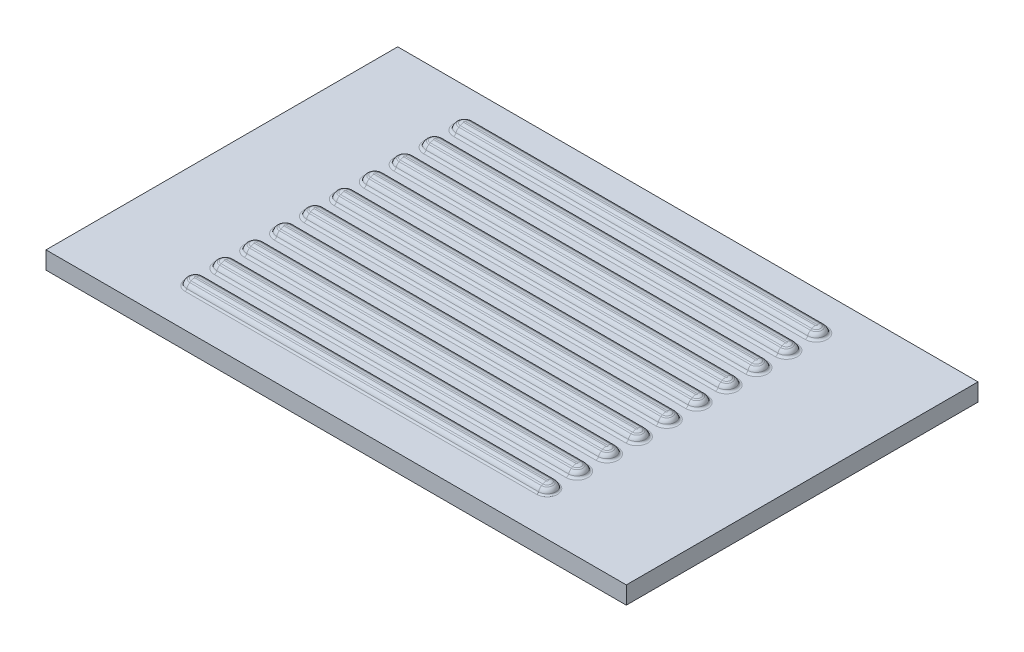
from build123d import *
from OCP.BRepFilletAPI import BRepFilletAPI_MakeChamfer

# Parameters (mm, degrees)
SKETCH1_W                   = 30000
SKETCH1_H                   = 20000
BOSS_EXTRUDE1_DEPTH         = 1000
SKETCH4_W                   = 3000
SKETCH4_H                   = 20000
BOSS_EXTRUDE3_DEPTH         = 1000
BOSS_EXTRUDE2_DEPTH         = 400
CHAMFER1_SIZE               = 200
CHAMFER1_SIZE2              = 346.410161514
FILLET3_R                   = 400
FILLET4_R                   = 350
FILLET2_R                   = 100
LPATTERN3_COUNT             = 10
LPATTERN3_PITCH             = 1700
CHAMFER1_OF_LPATTERN3_SIZE  = 200
CHAMFER1_OF_LPATTERN3_SIZE2 = 346.410161514
FILLET3_OF_LPATTERN3_R      = 400
FILLET4_OF_LPATTERN3_R      = 350
FILLET5_R                   = 150
FILLET6_R                   = 150
FILLET7_R                   = 150
FILLET8_R                   = 150
FILLET9_R                   = 150
FILLET10_R                  = 150
FILLET11_R                  = 150
FILLET12_R                  = 150
FILLET13_R                  = 150


with BuildPart() as part:
    # Sketch1 → Boss-Extrude1 (new body)
    with BuildSketch(Plane(origin=(0, 0, 0), x_dir=(1, 0, 0), z_dir=(0, 1, 0))):
        Rectangle(SKETCH1_W, SKETCH1_H)
    extrude(amount=-BOSS_EXTRUDE1_DEPTH)

    # Sketch4 → Boss-Extrude3 (add)
    with BuildSketch(Plane(origin=(0, 0, 0), x_dir=(1, 0, 0), z_dir=(0, 1, 0))):
        with Locations((-16500, 0)):
            Rectangle(SKETCH4_W, SKETCH4_H)
    extrude(amount=-BOSS_EXTRUDE3_DEPTH)

    # Sketch3 → Boss-Extrude2 (add)
    with BuildSketch(Plane(origin=(0, 0, 0), x_dir=(1, 0, 0), z_dir=(0, 1, 0))):
        with BuildLine():
            Line((-12000, -7000), (8000, -7000))
            ThreePointArc((8000, -7000), (8500, -7500), (8000, -8000))
            Line((8000, -8000), (-12000, -8000))
            ThreePointArc((-12000, -8000), (-12500, -7500), (-12000, -7000))
        make_face()
    boss_extrude2 = extrude(amount=BOSS_EXTRUDE2_DEPTH)

    # Chamfer1: one chamfer whose edges measure the first distance from different faces: ONE call of the kernel's chamfer builder (chamfer() names one face for all edges)
    chamfer1_edges_1 = [part.edges().sort_by_distance(p)[0] for p in [
        (-12500, 400, 7500),
    ]]
    chamfer1_side_1 = [part.faces().sort_by_distance(p)[0] for p in [
        (-12500, 200, 7500),
    ]]
    chamfer1_edges_2 = [part.edges().sort_by_distance(p)[0] for p in [
        (-2000, 400, 8000),
    ]]
    chamfer1_side_2 = [part.faces().sort_by_distance(p)[0] for p in [
        (-2000, 200, 8000),
    ]]
    chamfer1_edges_3 = [part.edges().sort_by_distance(p)[0] for p in [
        (8500, 400, 7500),
    ]]
    chamfer1_side_3 = [part.faces().sort_by_distance(p)[0] for p in [
        (8500, 200, 7500),
    ]]
    chamfer1_edges_4 = [part.edges().sort_by_distance(p)[0] for p in [
        (-2000, 400, 7000),
    ]]
    chamfer1_side_4 = [part.faces().sort_by_distance(p)[0] for p in [
        (-2000, 200, 7000),
    ]]
    chamfer1 = BRepFilletAPI_MakeChamfer(part.part.solid().wrapped)
    for e in chamfer1_edges_1:
        chamfer1.Add(CHAMFER1_SIZE, CHAMFER1_SIZE2, e.wrapped, chamfer1_side_1[0].wrapped)  # the first distance lies on this face
    for e in chamfer1_edges_2:
        chamfer1.Add(CHAMFER1_SIZE, CHAMFER1_SIZE2, e.wrapped, chamfer1_side_2[0].wrapped)  # the first distance lies on this face
    for e in chamfer1_edges_3:
        chamfer1.Add(CHAMFER1_SIZE, CHAMFER1_SIZE2, e.wrapped, chamfer1_side_3[0].wrapped)  # the first distance lies on this face
    for e in chamfer1_edges_4:
        chamfer1.Add(CHAMFER1_SIZE, CHAMFER1_SIZE2, e.wrapped, chamfer1_side_4[0].wrapped)  # the first distance lies on this face
    add(Compound.cast(chamfer1.Shape()), mode=Mode.REPLACE)

    # Fillet3
    fillet3_edges = [part.edges().sort_by_distance(p)[0] for p in [
        (-12153.589838486, 400, 7500),
        (-2000, 400, 7653.589838486),
        (8153.589838486, 400, 7500),
        (-2000, 400, 7346.410161514),
    ]]
    fillet(fillet3_edges, radius=FILLET3_R)

    # Fillet4
    # the kernel refuses this fillet: 350 mm, written as the material it takes off along each edge
    with BuildSketch(Plane(origin=(-12000, 200, 7500), x_dir=(0, 0, 1), z_dir=(1, 0, 0))) as fillet4_piece_1:
        with BuildLine():
            CenterArc((150.006157763, 202.076149403), FILLET4_R, 300, 59.660127726)
            Line((500, 200), (506.999876845, 199.958477012))
            ThreePointArc((506.999876845, 199.958477012), (507, 100), (507, 0))
            Line((507, 0), (503.5, -6.062177826))
            Line((503.5, -6.062177826), (328.506157763, -107.094919748))
            Line((328.506157763, -107.094919748), (325.006157763, -101.032741922))
        make_face()
    revolve(axis=Axis((-12000, 200, 7500), (0, -1, 0)), revolution_arc=180, mode=Mode.SUBTRACT)
    with BuildSketch(Plane(origin=(8000, 200, 8000), x_dir=(0, 0.49999999999999817, -0.8660254037844398), z_dir=(-1, 0, 0)), Plane(origin=(-12000, 200, 7000), x_dir=(0, 0.4999999999999985, 0.8660254037844395), z_dir=(1, 0, 0))) as fillet4_piece_2:
        with BuildLine():
            CenterArc((202.065483844, 350), FILLET4_R, 210.339872274, 59.660127726)
            Line((-100, 173.205080757), (-106.041309677, 169.669182372))
            ThreePointArc((-106.041309677, 169.669182372), (-56.062177826, 83.102540378), (-6.062177826, -3.5))
            Line((-6.062177826, -3.5), (0, -7))
            Line((0, -7), (202.065483844, -7))
            Line((202.065483844, -7), (202.065483844, 0))
        make_face()
    extrude(amount=20000, mode=Mode.SUBTRACT)
    with BuildSketch(Plane(origin=(8000, 200, 7500), x_dir=(0, 0, -1), z_dir=(-1, 0, 0))) as fillet4_piece_3:
        with BuildLine():
            CenterArc((150.006157763, 202.076149403), FILLET4_R, 300, 59.660127726)
            Line((500, 200), (506.999876845, 199.958477012))
            ThreePointArc((506.999876845, 199.958477012), (507, 100), (507, 0))
            Line((507, 0), (503.5, -6.062177826))
            Line((503.5, -6.062177826), (328.506157763, -107.094919748))
            Line((328.506157763, -107.094919748), (325.006157763, -101.032741922))
        make_face()
    revolve(axis=Axis((8000, 200, 7500), (0, -1, 0)), revolution_arc=180, mode=Mode.SUBTRACT)

    # Fillet2
    fillet2_edges = [part.edges().sort_by_distance(p)[0] for p in [
        (-12500, 0, 7500),
        (-2000, 0, 8000),
        (8500, 0, 7500),
        (-2000, 0, 7000),
    ]]
    fillet(fillet2_edges, radius=FILLET2_R)

    # LPattern3: Boss-Extrude2 ×10
    with Locations(*[(0, 0, -i * LPATTERN3_PITCH) for i in range(1, LPATTERN3_COUNT)]):
        add(boss_extrude2)

    # Chamfer1 of LPattern3: one chamfer whose edges measure the first distance from different faces: ONE call of the kernel's chamfer builder (chamfer() names one face for all edges)
    chamfer1_of_lpattern3_edges_1 = [part.edges().sort_by_distance(p)[0] for p in [
        (-12500, 400, 5800),
    ]]
    chamfer1_of_lpattern3_side_1 = [part.faces().sort_by_distance(p)[0] for p in [
        (-12500, 200, 5800),
    ]]
    chamfer1_of_lpattern3_edges_2 = [part.edges().sort_by_distance(p)[0] for p in [
        (-2000, 400, 6300),
    ]]
    chamfer1_of_lpattern3_side_2 = [part.faces().sort_by_distance(p)[0] for p in [
        (-2000, 200, 6300),
    ]]
    chamfer1_of_lpattern3_edges_3 = [part.edges().sort_by_distance(p)[0] for p in [
        (8500, 400, 5800),
    ]]
    chamfer1_of_lpattern3_side_3 = [part.faces().sort_by_distance(p)[0] for p in [
        (8500, 200, 5800),
    ]]
    chamfer1_of_lpattern3_edges_4 = [part.edges().sort_by_distance(p)[0] for p in [
        (-2000, 400, 5300),
    ]]
    chamfer1_of_lpattern3_side_4 = [part.faces().sort_by_distance(p)[0] for p in [
        (-2000, 200, 5300),
    ]]
    chamfer1_of_lpattern3_edges_5 = [part.edges().sort_by_distance(p)[0] for p in [
        (-12500, 400, 4100),
    ]]
    chamfer1_of_lpattern3_side_5 = [part.faces().sort_by_distance(p)[0] for p in [
        (-12500, 200, 4100),
    ]]
    chamfer1_of_lpattern3_edges_6 = [part.edges().sort_by_distance(p)[0] for p in [
        (-2000, 400, 4600),
    ]]
    chamfer1_of_lpattern3_side_6 = [part.faces().sort_by_distance(p)[0] for p in [
        (-2000, 200, 4600),
    ]]
    chamfer1_of_lpattern3_edges_7 = [part.edges().sort_by_distance(p)[0] for p in [
        (8500, 400, 4100),
    ]]
    chamfer1_of_lpattern3_side_7 = [part.faces().sort_by_distance(p)[0] for p in [
        (8500, 200, 4100),
    ]]
    chamfer1_of_lpattern3_edges_8 = [part.edges().sort_by_distance(p)[0] for p in [
        (-2000, 400, 3600),
    ]]
    chamfer1_of_lpattern3_side_8 = [part.faces().sort_by_distance(p)[0] for p in [
        (-2000, 200, 3600),
    ]]
    chamfer1_of_lpattern3_edges_9 = [part.edges().sort_by_distance(p)[0] for p in [
        (-12500, 400, 2400),
    ]]
    chamfer1_of_lpattern3_side_9 = [part.faces().sort_by_distance(p)[0] for p in [
        (-12500, 200, 2400),
    ]]
    chamfer1_of_lpattern3_edges_10 = [part.edges().sort_by_distance(p)[0] for p in [
        (-2000, 400, 2900),
    ]]
    chamfer1_of_lpattern3_side_10 = [part.faces().sort_by_distance(p)[0] for p in [
        (-2000, 200, 2900),
    ]]
    chamfer1_of_lpattern3_edges_11 = [part.edges().sort_by_distance(p)[0] for p in [
        (8500, 400, 2400),
    ]]
    chamfer1_of_lpattern3_side_11 = [part.faces().sort_by_distance(p)[0] for p in [
        (8500, 200, 2400),
    ]]
    chamfer1_of_lpattern3_edges_12 = [part.edges().sort_by_distance(p)[0] for p in [
        (-2000, 400, 1900),
    ]]
    chamfer1_of_lpattern3_side_12 = [part.faces().sort_by_distance(p)[0] for p in [
        (-2000, 200, 1900),
    ]]
    chamfer1_of_lpattern3_edges_13 = [part.edges().sort_by_distance(p)[0] for p in [
        (-12500, 400, 700),
    ]]
    chamfer1_of_lpattern3_side_13 = [part.faces().sort_by_distance(p)[0] for p in [
        (-12500, 200, 700),
    ]]
    chamfer1_of_lpattern3_edges_14 = [part.edges().sort_by_distance(p)[0] for p in [
        (-2000, 400, 1200),
    ]]
    chamfer1_of_lpattern3_side_14 = [part.faces().sort_by_distance(p)[0] for p in [
        (-2000, 200, 1200),
    ]]
    chamfer1_of_lpattern3_edges_15 = [part.edges().sort_by_distance(p)[0] for p in [
        (8500, 400, 700),
    ]]
    chamfer1_of_lpattern3_side_15 = [part.faces().sort_by_distance(p)[0] for p in [
        (8500, 200, 700),
    ]]
    chamfer1_of_lpattern3_edges_16 = [part.edges().sort_by_distance(p)[0] for p in [
        (-2000, 400, 200),
    ]]
    chamfer1_of_lpattern3_side_16 = [part.faces().sort_by_distance(p)[0] for p in [
        (-2000, 200, 200),
    ]]
    chamfer1_of_lpattern3_edges_17 = [part.edges().sort_by_distance(p)[0] for p in [
        (-12500, 400, -1000),
    ]]
    chamfer1_of_lpattern3_side_17 = [part.faces().sort_by_distance(p)[0] for p in [
        (-12500, 200, -1000),
    ]]
    chamfer1_of_lpattern3_edges_18 = [part.edges().sort_by_distance(p)[0] for p in [
        (-2000, 400, -500),
    ]]
    chamfer1_of_lpattern3_side_18 = [part.faces().sort_by_distance(p)[0] for p in [
        (-2000, 200, -500),
    ]]
    chamfer1_of_lpattern3_edges_19 = [part.edges().sort_by_distance(p)[0] for p in [
        (8500, 400, -1000),
    ]]
    chamfer1_of_lpattern3_side_19 = [part.faces().sort_by_distance(p)[0] for p in [
        (8500, 200, -1000),
    ]]
    chamfer1_of_lpattern3_edges_20 = [part.edges().sort_by_distance(p)[0] for p in [
        (-2000, 400, -1500),
    ]]
    chamfer1_of_lpattern3_side_20 = [part.faces().sort_by_distance(p)[0] for p in [
        (-2000, 200, -1500),
    ]]
    chamfer1_of_lpattern3_edges_21 = [part.edges().sort_by_distance(p)[0] for p in [
        (-12500, 400, -2700),
    ]]
    chamfer1_of_lpattern3_side_21 = [part.faces().sort_by_distance(p)[0] for p in [
        (-12500, 200, -2700),
    ]]
    chamfer1_of_lpattern3_edges_22 = [part.edges().sort_by_distance(p)[0] for p in [
        (-2000, 400, -2200),
    ]]
    chamfer1_of_lpattern3_side_22 = [part.faces().sort_by_distance(p)[0] for p in [
        (-2000, 200, -2200),
    ]]
    chamfer1_of_lpattern3_edges_23 = [part.edges().sort_by_distance(p)[0] for p in [
        (8500, 400, -2700),
    ]]
    chamfer1_of_lpattern3_side_23 = [part.faces().sort_by_distance(p)[0] for p in [
        (8500, 200, -2700),
    ]]
    chamfer1_of_lpattern3_edges_24 = [part.edges().sort_by_distance(p)[0] for p in [
        (-2000, 400, -3200),
    ]]
    chamfer1_of_lpattern3_side_24 = [part.faces().sort_by_distance(p)[0] for p in [
        (-2000, 200, -3200),
    ]]
    chamfer1_of_lpattern3_edges_25 = [part.edges().sort_by_distance(p)[0] for p in [
        (-12500, 400, -4400),
    ]]
    chamfer1_of_lpattern3_side_25 = [part.faces().sort_by_distance(p)[0] for p in [
        (-12500, 200, -4400),
    ]]
    chamfer1_of_lpattern3_edges_26 = [part.edges().sort_by_distance(p)[0] for p in [
        (-2000, 400, -3900),
    ]]
    chamfer1_of_lpattern3_side_26 = [part.faces().sort_by_distance(p)[0] for p in [
        (-2000, 200, -3900),
    ]]
    chamfer1_of_lpattern3_edges_27 = [part.edges().sort_by_distance(p)[0] for p in [
        (8500, 400, -4400),
    ]]
    chamfer1_of_lpattern3_side_27 = [part.faces().sort_by_distance(p)[0] for p in [
        (8500, 200, -4400),
    ]]
    chamfer1_of_lpattern3_edges_28 = [part.edges().sort_by_distance(p)[0] for p in [
        (-2000, 400, -4900),
    ]]
    chamfer1_of_lpattern3_side_28 = [part.faces().sort_by_distance(p)[0] for p in [
        (-2000, 200, -4900),
    ]]
    chamfer1_of_lpattern3_edges_29 = [part.edges().sort_by_distance(p)[0] for p in [
        (-12500, 400, -6100),
    ]]
    chamfer1_of_lpattern3_side_29 = [part.faces().sort_by_distance(p)[0] for p in [
        (-12500, 200, -6100),
    ]]
    chamfer1_of_lpattern3_edges_30 = [part.edges().sort_by_distance(p)[0] for p in [
        (-2000, 400, -5600),
    ]]
    chamfer1_of_lpattern3_side_30 = [part.faces().sort_by_distance(p)[0] for p in [
        (-2000, 200, -5600),
    ]]
    chamfer1_of_lpattern3_edges_31 = [part.edges().sort_by_distance(p)[0] for p in [
        (8500, 400, -6100),
    ]]
    chamfer1_of_lpattern3_side_31 = [part.faces().sort_by_distance(p)[0] for p in [
        (8500, 200, -6100),
    ]]
    chamfer1_of_lpattern3_edges_32 = [part.edges().sort_by_distance(p)[0] for p in [
        (-2000, 400, -6600),
    ]]
    chamfer1_of_lpattern3_side_32 = [part.faces().sort_by_distance(p)[0] for p in [
        (-2000, 200, -6600),
    ]]
    chamfer1_of_lpattern3_edges_33 = [part.edges().sort_by_distance(p)[0] for p in [
        (-12500, 400, -7800),
    ]]
    chamfer1_of_lpattern3_side_33 = [part.faces().sort_by_distance(p)[0] for p in [
        (-12500, 200, -7800),
    ]]
    chamfer1_of_lpattern3_edges_34 = [part.edges().sort_by_distance(p)[0] for p in [
        (-2000, 400, -7300),
    ]]
    chamfer1_of_lpattern3_side_34 = [part.faces().sort_by_distance(p)[0] for p in [
        (-2000, 200, -7300),
    ]]
    chamfer1_of_lpattern3_edges_35 = [part.edges().sort_by_distance(p)[0] for p in [
        (8500, 400, -7800),
    ]]
    chamfer1_of_lpattern3_side_35 = [part.faces().sort_by_distance(p)[0] for p in [
        (8500, 200, -7800),
    ]]
    chamfer1_of_lpattern3_edges_36 = [part.edges().sort_by_distance(p)[0] for p in [
        (-2000, 400, -8300),
    ]]
    chamfer1_of_lpattern3_side_36 = [part.faces().sort_by_distance(p)[0] for p in [
        (-2000, 200, -8300),
    ]]
    chamfer1_of_lpattern3 = BRepFilletAPI_MakeChamfer(part.part.solid().wrapped)
    for e in chamfer1_of_lpattern3_edges_1:
        chamfer1_of_lpattern3.Add(CHAMFER1_OF_LPATTERN3_SIZE, CHAMFER1_OF_LPATTERN3_SIZE2, e.wrapped, chamfer1_of_lpattern3_side_1[0].wrapped)  # the first distance lies on this face
    for e in chamfer1_of_lpattern3_edges_2:
        chamfer1_of_lpattern3.Add(CHAMFER1_OF_LPATTERN3_SIZE, CHAMFER1_OF_LPATTERN3_SIZE2, e.wrapped, chamfer1_of_lpattern3_side_2[0].wrapped)  # the first distance lies on this face
    for e in chamfer1_of_lpattern3_edges_3:
        chamfer1_of_lpattern3.Add(CHAMFER1_OF_LPATTERN3_SIZE, CHAMFER1_OF_LPATTERN3_SIZE2, e.wrapped, chamfer1_of_lpattern3_side_3[0].wrapped)  # the first distance lies on this face
    for e in chamfer1_of_lpattern3_edges_4:
        chamfer1_of_lpattern3.Add(CHAMFER1_OF_LPATTERN3_SIZE, CHAMFER1_OF_LPATTERN3_SIZE2, e.wrapped, chamfer1_of_lpattern3_side_4[0].wrapped)  # the first distance lies on this face
    for e in chamfer1_of_lpattern3_edges_5:
        chamfer1_of_lpattern3.Add(CHAMFER1_OF_LPATTERN3_SIZE, CHAMFER1_OF_LPATTERN3_SIZE2, e.wrapped, chamfer1_of_lpattern3_side_5[0].wrapped)  # the first distance lies on this face
    for e in chamfer1_of_lpattern3_edges_6:
        chamfer1_of_lpattern3.Add(CHAMFER1_OF_LPATTERN3_SIZE, CHAMFER1_OF_LPATTERN3_SIZE2, e.wrapped, chamfer1_of_lpattern3_side_6[0].wrapped)  # the first distance lies on this face
    for e in chamfer1_of_lpattern3_edges_7:
        chamfer1_of_lpattern3.Add(CHAMFER1_OF_LPATTERN3_SIZE, CHAMFER1_OF_LPATTERN3_SIZE2, e.wrapped, chamfer1_of_lpattern3_side_7[0].wrapped)  # the first distance lies on this face
    for e in chamfer1_of_lpattern3_edges_8:
        chamfer1_of_lpattern3.Add(CHAMFER1_OF_LPATTERN3_SIZE, CHAMFER1_OF_LPATTERN3_SIZE2, e.wrapped, chamfer1_of_lpattern3_side_8[0].wrapped)  # the first distance lies on this face
    for e in chamfer1_of_lpattern3_edges_9:
        chamfer1_of_lpattern3.Add(CHAMFER1_OF_LPATTERN3_SIZE, CHAMFER1_OF_LPATTERN3_SIZE2, e.wrapped, chamfer1_of_lpattern3_side_9[0].wrapped)  # the first distance lies on this face
    for e in chamfer1_of_lpattern3_edges_10:
        chamfer1_of_lpattern3.Add(CHAMFER1_OF_LPATTERN3_SIZE, CHAMFER1_OF_LPATTERN3_SIZE2, e.wrapped, chamfer1_of_lpattern3_side_10[0].wrapped)  # the first distance lies on this face
    for e in chamfer1_of_lpattern3_edges_11:
        chamfer1_of_lpattern3.Add(CHAMFER1_OF_LPATTERN3_SIZE, CHAMFER1_OF_LPATTERN3_SIZE2, e.wrapped, chamfer1_of_lpattern3_side_11[0].wrapped)  # the first distance lies on this face
    for e in chamfer1_of_lpattern3_edges_12:
        chamfer1_of_lpattern3.Add(CHAMFER1_OF_LPATTERN3_SIZE, CHAMFER1_OF_LPATTERN3_SIZE2, e.wrapped, chamfer1_of_lpattern3_side_12[0].wrapped)  # the first distance lies on this face
    for e in chamfer1_of_lpattern3_edges_13:
        chamfer1_of_lpattern3.Add(CHAMFER1_OF_LPATTERN3_SIZE, CHAMFER1_OF_LPATTERN3_SIZE2, e.wrapped, chamfer1_of_lpattern3_side_13[0].wrapped)  # the first distance lies on this face
    for e in chamfer1_of_lpattern3_edges_14:
        chamfer1_of_lpattern3.Add(CHAMFER1_OF_LPATTERN3_SIZE, CHAMFER1_OF_LPATTERN3_SIZE2, e.wrapped, chamfer1_of_lpattern3_side_14[0].wrapped)  # the first distance lies on this face
    for e in chamfer1_of_lpattern3_edges_15:
        chamfer1_of_lpattern3.Add(CHAMFER1_OF_LPATTERN3_SIZE, CHAMFER1_OF_LPATTERN3_SIZE2, e.wrapped, chamfer1_of_lpattern3_side_15[0].wrapped)  # the first distance lies on this face
    for e in chamfer1_of_lpattern3_edges_16:
        chamfer1_of_lpattern3.Add(CHAMFER1_OF_LPATTERN3_SIZE, CHAMFER1_OF_LPATTERN3_SIZE2, e.wrapped, chamfer1_of_lpattern3_side_16[0].wrapped)  # the first distance lies on this face
    for e in chamfer1_of_lpattern3_edges_17:
        chamfer1_of_lpattern3.Add(CHAMFER1_OF_LPATTERN3_SIZE, CHAMFER1_OF_LPATTERN3_SIZE2, e.wrapped, chamfer1_of_lpattern3_side_17[0].wrapped)  # the first distance lies on this face
    for e in chamfer1_of_lpattern3_edges_18:
        chamfer1_of_lpattern3.Add(CHAMFER1_OF_LPATTERN3_SIZE, CHAMFER1_OF_LPATTERN3_SIZE2, e.wrapped, chamfer1_of_lpattern3_side_18[0].wrapped)  # the first distance lies on this face
    for e in chamfer1_of_lpattern3_edges_19:
        chamfer1_of_lpattern3.Add(CHAMFER1_OF_LPATTERN3_SIZE, CHAMFER1_OF_LPATTERN3_SIZE2, e.wrapped, chamfer1_of_lpattern3_side_19[0].wrapped)  # the first distance lies on this face
    for e in chamfer1_of_lpattern3_edges_20:
        chamfer1_of_lpattern3.Add(CHAMFER1_OF_LPATTERN3_SIZE, CHAMFER1_OF_LPATTERN3_SIZE2, e.wrapped, chamfer1_of_lpattern3_side_20[0].wrapped)  # the first distance lies on this face
    for e in chamfer1_of_lpattern3_edges_21:
        chamfer1_of_lpattern3.Add(CHAMFER1_OF_LPATTERN3_SIZE, CHAMFER1_OF_LPATTERN3_SIZE2, e.wrapped, chamfer1_of_lpattern3_side_21[0].wrapped)  # the first distance lies on this face
    for e in chamfer1_of_lpattern3_edges_22:
        chamfer1_of_lpattern3.Add(CHAMFER1_OF_LPATTERN3_SIZE, CHAMFER1_OF_LPATTERN3_SIZE2, e.wrapped, chamfer1_of_lpattern3_side_22[0].wrapped)  # the first distance lies on this face
    for e in chamfer1_of_lpattern3_edges_23:
        chamfer1_of_lpattern3.Add(CHAMFER1_OF_LPATTERN3_SIZE, CHAMFER1_OF_LPATTERN3_SIZE2, e.wrapped, chamfer1_of_lpattern3_side_23[0].wrapped)  # the first distance lies on this face
    for e in chamfer1_of_lpattern3_edges_24:
        chamfer1_of_lpattern3.Add(CHAMFER1_OF_LPATTERN3_SIZE, CHAMFER1_OF_LPATTERN3_SIZE2, e.wrapped, chamfer1_of_lpattern3_side_24[0].wrapped)  # the first distance lies on this face
    for e in chamfer1_of_lpattern3_edges_25:
        chamfer1_of_lpattern3.Add(CHAMFER1_OF_LPATTERN3_SIZE, CHAMFER1_OF_LPATTERN3_SIZE2, e.wrapped, chamfer1_of_lpattern3_side_25[0].wrapped)  # the first distance lies on this face
    for e in chamfer1_of_lpattern3_edges_26:
        chamfer1_of_lpattern3.Add(CHAMFER1_OF_LPATTERN3_SIZE, CHAMFER1_OF_LPATTERN3_SIZE2, e.wrapped, chamfer1_of_lpattern3_side_26[0].wrapped)  # the first distance lies on this face
    for e in chamfer1_of_lpattern3_edges_27:
        chamfer1_of_lpattern3.Add(CHAMFER1_OF_LPATTERN3_SIZE, CHAMFER1_OF_LPATTERN3_SIZE2, e.wrapped, chamfer1_of_lpattern3_side_27[0].wrapped)  # the first distance lies on this face
    for e in chamfer1_of_lpattern3_edges_28:
        chamfer1_of_lpattern3.Add(CHAMFER1_OF_LPATTERN3_SIZE, CHAMFER1_OF_LPATTERN3_SIZE2, e.wrapped, chamfer1_of_lpattern3_side_28[0].wrapped)  # the first distance lies on this face
    for e in chamfer1_of_lpattern3_edges_29:
        chamfer1_of_lpattern3.Add(CHAMFER1_OF_LPATTERN3_SIZE, CHAMFER1_OF_LPATTERN3_SIZE2, e.wrapped, chamfer1_of_lpattern3_side_29[0].wrapped)  # the first distance lies on this face
    for e in chamfer1_of_lpattern3_edges_30:
        chamfer1_of_lpattern3.Add(CHAMFER1_OF_LPATTERN3_SIZE, CHAMFER1_OF_LPATTERN3_SIZE2, e.wrapped, chamfer1_of_lpattern3_side_30[0].wrapped)  # the first distance lies on this face
    for e in chamfer1_of_lpattern3_edges_31:
        chamfer1_of_lpattern3.Add(CHAMFER1_OF_LPATTERN3_SIZE, CHAMFER1_OF_LPATTERN3_SIZE2, e.wrapped, chamfer1_of_lpattern3_side_31[0].wrapped)  # the first distance lies on this face
    for e in chamfer1_of_lpattern3_edges_32:
        chamfer1_of_lpattern3.Add(CHAMFER1_OF_LPATTERN3_SIZE, CHAMFER1_OF_LPATTERN3_SIZE2, e.wrapped, chamfer1_of_lpattern3_side_32[0].wrapped)  # the first distance lies on this face
    for e in chamfer1_of_lpattern3_edges_33:
        chamfer1_of_lpattern3.Add(CHAMFER1_OF_LPATTERN3_SIZE, CHAMFER1_OF_LPATTERN3_SIZE2, e.wrapped, chamfer1_of_lpattern3_side_33[0].wrapped)  # the first distance lies on this face
    for e in chamfer1_of_lpattern3_edges_34:
        chamfer1_of_lpattern3.Add(CHAMFER1_OF_LPATTERN3_SIZE, CHAMFER1_OF_LPATTERN3_SIZE2, e.wrapped, chamfer1_of_lpattern3_side_34[0].wrapped)  # the first distance lies on this face
    for e in chamfer1_of_lpattern3_edges_35:
        chamfer1_of_lpattern3.Add(CHAMFER1_OF_LPATTERN3_SIZE, CHAMFER1_OF_LPATTERN3_SIZE2, e.wrapped, chamfer1_of_lpattern3_side_35[0].wrapped)  # the first distance lies on this face
    for e in chamfer1_of_lpattern3_edges_36:
        chamfer1_of_lpattern3.Add(CHAMFER1_OF_LPATTERN3_SIZE, CHAMFER1_OF_LPATTERN3_SIZE2, e.wrapped, chamfer1_of_lpattern3_side_36[0].wrapped)  # the first distance lies on this face
    add(Compound.cast(chamfer1_of_lpattern3.Shape()), mode=Mode.REPLACE)

    # Fillet3 of LPattern3
    fillet3_of_lpattern3_edges = [part.edges().sort_by_distance(p)[0] for p in [
        (-12153.589838486, 400, 5800),
        (-2000, 400, 5953.589838486),
        (8153.589838486, 400, 5800),
        (-2000, 400, 5646.410161514),
        (-12153.589838486, 400, 4100),
        (-2000, 400, 4253.589838486),
        (8153.589838486, 400, 4100),
        (-2000, 400, 3946.410161514),
        (-12153.589838486, 400, 2400),
        (-2000, 400, 2553.589838486),
        (8153.589838486, 400, 2400),
        (-2000, 400, 2246.410161514),
        (-12153.589838486, 400, 700),
        (-2000, 400, 853.589838486),
        (8153.589838486, 400, 700),
        (-2000, 400, 546.410161514),
        (-12153.589838486, 400, -1000),
        (-2000, 400, -846.410161514),
        (8153.589838486, 400, -1000),
        (-2000, 400, -1153.589838486),
        (-12153.589838486, 400, -2700),
        (-2000, 400, -2546.410161514),
        (8153.589838486, 400, -2700),
        (-2000, 400, -2853.589838486),
        (-12153.589838486, 400, -4400),
        (-2000, 400, -4246.410161514),
        (8153.589838486, 400, -4400),
        (-2000, 400, -4553.589838486),
        (-12153.589838486, 400, -6100),
        (-2000, 400, -5946.410161514),
        (8153.589838486, 400, -6100),
        (-2000, 400, -6253.589838486),
        (-12153.589838486, 400, -7800),
        (-2000, 400, -7646.410161514),
        (8153.589838486, 400, -7800),
        (-2000, 400, -7953.589838486),
    ]]
    fillet(fillet3_of_lpattern3_edges, radius=FILLET3_OF_LPATTERN3_R)

    # Fillet4 of LPattern3
    # the kernel refuses this fillet: 350 mm, written as the material it takes off along each edge
    with BuildSketch(Plane(origin=(-12000, 200, 5800), x_dir=(0, 0, 1), z_dir=(1, 0, 0))) as fillet4_of_lpattern3_piece_1:
        with BuildLine():
            CenterArc((150.006157763, 202.076149403), FILLET4_OF_LPATTERN3_R, 300, 59.660127726)
            Line((500, 200), (506.999876845, 199.958477012))
            ThreePointArc((506.999876845, 199.958477012), (507, 100), (507, 0))
            Line((507, 0), (503.5, -6.062177826))
            Line((503.5, -6.062177826), (328.506157763, -107.094919748))
            Line((328.506157763, -107.094919748), (325.006157763, -101.032741922))
        make_face()
    revolve(axis=Axis((-12000, 200, 5800), (0, -1, 0)), revolution_arc=180, mode=Mode.SUBTRACT)
    with BuildSketch(Plane(origin=(8000, 200, 6300), x_dir=(0, 0.4999999999999985, -0.8660254037844395), z_dir=(-1, 0, 0)), Plane(origin=(-12000, 200, 5300), x_dir=(0, 0.49999999999999817, 0.8660254037844398), z_dir=(1, 0, 0))) as fillet4_of_lpattern3_piece_2:
        with BuildLine():
            CenterArc((202.065483844, 350), FILLET4_OF_LPATTERN3_R, 210.339872274, 59.660127726)
            Line((-100, 173.205080757), (-106.041309677, 169.669182372))
            ThreePointArc((-106.041309677, 169.669182372), (-56.062177826, 83.102540378), (-6.062177826, -3.5))
            Line((-6.062177826, -3.5), (0, -7))
            Line((0, -7), (202.065483844, -7))
            Line((202.065483844, -7), (202.065483844, 0))
        make_face()
    extrude(amount=20000, mode=Mode.SUBTRACT)
    with BuildSketch(Plane(origin=(8000, 200, 5800), x_dir=(0, 0, -1), z_dir=(-1, 0, 0))) as fillet4_of_lpattern3_piece_3:
        with BuildLine():
            CenterArc((150.006157763, 202.076149403), FILLET4_OF_LPATTERN3_R, 300, 59.660127726)
            Line((500, 200), (506.999876845, 199.958477012))
            ThreePointArc((506.999876845, 199.958477012), (507, 100), (507, 0))
            Line((507, 0), (503.5, -6.062177826))
            Line((503.5, -6.062177826), (328.506157763, -107.094919748))
            Line((328.506157763, -107.094919748), (325.006157763, -101.032741922))
        make_face()
    revolve(axis=Axis((8000, 200, 5800), (0, -1, 0)), revolution_arc=180, mode=Mode.SUBTRACT)
    with BuildSketch(Plane(origin=(-12000, 200, 4100), x_dir=(0, 0, 1), z_dir=(1, 0, 0))) as fillet4_of_lpattern3_piece_4:
        with BuildLine():
            CenterArc((150.006157763, 202.076149403), FILLET4_OF_LPATTERN3_R, 300, 59.660127726)
            Line((325.006157763, -101.032741922), (328.506157763, -107.094919748))
            Line((328.506157763, -107.094919748), (503.5, -6.062177826))
            Line((503.5, -6.062177826), (507, 0))
            ThreePointArc((507, 0), (507, 100), (506.999876845, 199.958477012))
            Line((506.999876845, 199.958477012), (500, 200))
        make_face()
    revolve(axis=Axis((-12000, 200, 4100), (0, -1, 0)), revolution_arc=180, mode=Mode.SUBTRACT)
    with BuildSketch(Plane(origin=(8000, 200, 4600), x_dir=(0, -1, 0), z_dir=(-1, 0, 0)), Plane(origin=(-12000, 200, 3600), x_dir=(0, -1, 0), z_dir=(1, 0, 0)), Plane(origin=(8000, 200, 2900), x_dir=(0, -1, 0), z_dir=(-1, 0, 0)), Plane(origin=(-12000, 200, 1900), x_dir=(0, -1, 0), z_dir=(1, 0, 0)), Plane(origin=(8000, 200, 1200), x_dir=(0, -1, 0), z_dir=(-1, 0, 0)), Plane(origin=(-12000, 200, 200), x_dir=(0, -1, 0), z_dir=(1, 0, 0)), Plane(origin=(8000, 200, -500), x_dir=(0, -1, 0), z_dir=(-1, 0, 0)), Plane(origin=(-12000, 200, -1500), x_dir=(0, -1, 0), z_dir=(1, 0, 0)), Plane(origin=(8000, 200, -2200), x_dir=(0, -1, 0), z_dir=(-1, 0, 0)), Plane(origin=(-12000, 200, -3200), x_dir=(0, -1, 0), z_dir=(1, 0, 0)), Plane(origin=(8000, 200, -3900), x_dir=(0, -1, 0), z_dir=(-1, 0, 0)), Plane(origin=(-12000, 200, -4900), x_dir=(0, -1, 0), z_dir=(1, 0, 0)), Plane(origin=(8000, 200, -5600), x_dir=(0, -1, 0), z_dir=(-1, 0, 0)), Plane(origin=(-12000, 200, -6600), x_dir=(0, -1, 0), z_dir=(1, 0, 0)), Plane(origin=(8000, 200, -7300), x_dir=(0, -1, 0), z_dir=(-1, 0, 0)), Plane(origin=(-12000, 200, -8300), x_dir=(0, -1, 0), z_dir=(1, 0, 0))) as fillet4_of_lpattern3_piece_5:
        with BuildLine():
            CenterArc((202.076149403, -349.993842237), FILLET4_OF_LPATTERN3_R, 90.339872274, 59.660127726)
            Line((-101.032741922, -174.993842237), (-107.094919748, -171.493842237))
            Line((-107.094919748, -171.493842237), (-6.062177826, 3.5))
            Line((-6.062177826, 3.5), (0, 7))
            ThreePointArc((0, 7), (100, 7), (199.958477012, 6.999876845))
            Line((199.958477012, 6.999876845), (200, 0))
        make_face()
    extrude(amount=20000, mode=Mode.SUBTRACT)
    with BuildSketch(Plane(origin=(8000, 200, 4100), x_dir=(0, 0, -1), z_dir=(-1, 0, 0))) as fillet4_of_lpattern3_piece_6:
        with BuildLine():
            CenterArc((150.006157763, 202.076149403), FILLET4_OF_LPATTERN3_R, 300, 59.660127726)
            Line((325.006157763, -101.032741922), (328.506157763, -107.094919748))
            Line((328.506157763, -107.094919748), (503.5, -6.062177826))
            Line((503.5, -6.062177826), (507, 0))
            ThreePointArc((507, 0), (507, 100), (506.999876845, 199.958477012))
            Line((506.999876845, 199.958477012), (500, 200))
        make_face()
    revolve(axis=Axis((8000, 200, 4100), (0, -1, 0)), revolution_arc=180, mode=Mode.SUBTRACT)
    with BuildSketch(Plane(origin=(-12000, 200, 2400), x_dir=(0, 0, 1), z_dir=(1, 0, 0))) as fillet4_of_lpattern3_piece_7:
        with BuildLine():
            CenterArc((150.006157763, 202.076149403), FILLET4_OF_LPATTERN3_R, 300, 59.660127726)
            Line((325.006157763, -101.032741922), (328.506157763, -107.094919748))
            Line((328.506157763, -107.094919748), (503.5, -6.062177826))
            Line((503.5, -6.062177826), (507, 0))
            ThreePointArc((507, 0), (507, 100), (506.999876845, 199.958477012))
            Line((506.999876845, 199.958477012), (500, 200))
        make_face()
    revolve(axis=Axis((-12000, 200, 2400), (0, -1, 0)), revolution_arc=180, mode=Mode.SUBTRACT)
    with BuildSketch(Plane(origin=(8000, 200, 2400), x_dir=(0, 0, -1), z_dir=(-1, 0, 0))) as fillet4_of_lpattern3_piece_8:
        with BuildLine():
            CenterArc((150.006157763, 202.076149403), FILLET4_OF_LPATTERN3_R, 300, 59.660127726)
            Line((325.006157763, -101.032741922), (328.506157763, -107.094919748))
            Line((328.506157763, -107.094919748), (503.5, -6.062177826))
            Line((503.5, -6.062177826), (507, 0))
            ThreePointArc((507, 0), (507, 100), (506.999876845, 199.958477012))
            Line((506.999876845, 199.958477012), (500, 200))
        make_face()
    revolve(axis=Axis((8000, 200, 2400), (0, -1, 0)), revolution_arc=180, mode=Mode.SUBTRACT)
    with BuildSketch(Plane(origin=(-12000, 200, 700), x_dir=(0, 0, 1), z_dir=(1, 0, 0))) as fillet4_of_lpattern3_piece_9:
        with BuildLine():
            CenterArc((150.006157763, 202.076149403), FILLET4_OF_LPATTERN3_R, 300, 59.660127726)
            Line((325.006157763, -101.032741922), (328.506157763, -107.094919748))
            Line((328.506157763, -107.094919748), (503.5, -6.062177826))
            Line((503.5, -6.062177826), (507, 0))
            ThreePointArc((507, 0), (507, 100), (506.999876845, 199.958477012))
            Line((506.999876845, 199.958477012), (500, 200))
        make_face()
    revolve(axis=Axis((-12000, 200, 700), (0, -1, 0)), revolution_arc=180, mode=Mode.SUBTRACT)
    with BuildSketch(Plane(origin=(8000, 200, 700), x_dir=(0, 0, -1), z_dir=(-1, 0, 0))) as fillet4_of_lpattern3_piece_10:
        with BuildLine():
            CenterArc((150.006157763, 202.076149403), FILLET4_OF_LPATTERN3_R, 300, 59.660127726)
            Line((325.006157763, -101.032741922), (328.506157763, -107.094919748))
            Line((328.506157763, -107.094919748), (503.5, -6.062177826))
            Line((503.5, -6.062177826), (507, 0))
            ThreePointArc((507, 0), (507, 100), (506.999876845, 199.958477012))
            Line((506.999876845, 199.958477012), (500, 200))
        make_face()
    revolve(axis=Axis((8000, 200, 700), (0, -1, 0)), revolution_arc=180, mode=Mode.SUBTRACT)
    with BuildSketch(Plane(origin=(-12000, 200, -1000), x_dir=(0, 0, 1), z_dir=(1, 0, 0))) as fillet4_of_lpattern3_piece_11:
        with BuildLine():
            CenterArc((150.006157763, 202.076149403), FILLET4_OF_LPATTERN3_R, 300, 59.660127726)
            Line((325.006157763, -101.032741922), (328.506157763, -107.094919748))
            Line((328.506157763, -107.094919748), (503.5, -6.062177826))
            Line((503.5, -6.062177826), (507, 0))
            ThreePointArc((507, 0), (507, 100), (506.999876845, 199.958477012))
            Line((506.999876845, 199.958477012), (500, 200))
        make_face()
    revolve(axis=Axis((-12000, 200, -1000), (0, -1, 0)), revolution_arc=180, mode=Mode.SUBTRACT)
    with BuildSketch(Plane(origin=(8000, 200, -1000), x_dir=(0, 0, -1), z_dir=(-1, 0, 0))) as fillet4_of_lpattern3_piece_12:
        with BuildLine():
            CenterArc((150.006157763, 202.076149403), FILLET4_OF_LPATTERN3_R, 300, 59.660127726)
            Line((325.006157763, -101.032741922), (328.506157763, -107.094919748))
            Line((328.506157763, -107.094919748), (503.5, -6.062177826))
            Line((503.5, -6.062177826), (507, 0))
            ThreePointArc((507, 0), (507, 100), (506.999876845, 199.958477012))
            Line((506.999876845, 199.958477012), (500, 200))
        make_face()
    revolve(axis=Axis((8000, 200, -1000), (0, -1, 0)), revolution_arc=180, mode=Mode.SUBTRACT)
    with BuildSketch(Plane(origin=(-12000, 200, -2700), x_dir=(0, 0, 1), z_dir=(1, 0, 0))) as fillet4_of_lpattern3_piece_13:
        with BuildLine():
            CenterArc((150.006157763, 202.076149403), FILLET4_OF_LPATTERN3_R, 300, 59.660127726)
            Line((325.006157763, -101.032741922), (328.506157763, -107.094919748))
            Line((328.506157763, -107.094919748), (503.5, -6.062177826))
            Line((503.5, -6.062177826), (507, 0))
            ThreePointArc((507, 0), (507, 100), (506.999876845, 199.958477012))
            Line((506.999876845, 199.958477012), (500, 200))
        make_face()
    revolve(axis=Axis((-12000, 200, -2700), (0, -1, 0)), revolution_arc=180, mode=Mode.SUBTRACT)
    with BuildSketch(Plane(origin=(8000, 200, -2700), x_dir=(0, 0, -1), z_dir=(-1, 0, 0))) as fillet4_of_lpattern3_piece_14:
        with BuildLine():
            CenterArc((150.006157763, 202.076149403), FILLET4_OF_LPATTERN3_R, 300, 59.660127726)
            Line((325.006157763, -101.032741922), (328.506157763, -107.094919748))
            Line((328.506157763, -107.094919748), (503.5, -6.062177826))
            Line((503.5, -6.062177826), (507, 0))
            ThreePointArc((507, 0), (507, 100), (506.999876845, 199.958477012))
            Line((506.999876845, 199.958477012), (500, 200))
        make_face()
    revolve(axis=Axis((8000, 200, -2700), (0, -1, 0)), revolution_arc=180, mode=Mode.SUBTRACT)
    with BuildSketch(Plane(origin=(-12000, 200, -4400), x_dir=(0, 0, 1), z_dir=(1, 0, 0))) as fillet4_of_lpattern3_piece_15:
        with BuildLine():
            CenterArc((150.006157763, 202.076149403), FILLET4_OF_LPATTERN3_R, 300, 59.660127726)
            Line((325.006157763, -101.032741922), (328.506157763, -107.094919748))
            Line((328.506157763, -107.094919748), (503.5, -6.062177826))
            Line((503.5, -6.062177826), (507, 0))
            ThreePointArc((507, 0), (507, 100), (506.999876845, 199.958477012))
            Line((506.999876845, 199.958477012), (500, 200))
        make_face()
    revolve(axis=Axis((-12000, 200, -4400), (0, -1, 0)), revolution_arc=180, mode=Mode.SUBTRACT)
    with BuildSketch(Plane(origin=(8000, 200, -4400), x_dir=(0, 0, -1), z_dir=(-1, 0, 0))) as fillet4_of_lpattern3_piece_16:
        with BuildLine():
            CenterArc((150.006157763, 202.076149403), FILLET4_OF_LPATTERN3_R, 300, 59.660127726)
            Line((325.006157763, -101.032741922), (328.506157763, -107.094919748))
            Line((328.506157763, -107.094919748), (503.5, -6.062177826))
            Line((503.5, -6.062177826), (507, 0))
            ThreePointArc((507, 0), (507, 100), (506.999876845, 199.958477012))
            Line((506.999876845, 199.958477012), (500, 200))
        make_face()
    revolve(axis=Axis((8000, 200, -4400), (0, -1, 0)), revolution_arc=180, mode=Mode.SUBTRACT)
    with BuildSketch(Plane(origin=(-12000, 200, -6100), x_dir=(0, 0, 1), z_dir=(1, 0, 0))) as fillet4_of_lpattern3_piece_17:
        with BuildLine():
            CenterArc((150.006157763, 202.076149403), FILLET4_OF_LPATTERN3_R, 300, 59.660127726)
            Line((325.006157763, -101.032741922), (328.506157763, -107.094919748))
            Line((328.506157763, -107.094919748), (503.5, -6.062177826))
            Line((503.5, -6.062177826), (507, 0))
            ThreePointArc((507, 0), (507, 100), (506.999876845, 199.958477012))
            Line((506.999876845, 199.958477012), (500, 200))
        make_face()
    revolve(axis=Axis((-12000, 200, -6100), (0, -1, 0)), revolution_arc=180, mode=Mode.SUBTRACT)
    with BuildSketch(Plane(origin=(8000, 200, -6100), x_dir=(0, 0, -1), z_dir=(-1, 0, 0))) as fillet4_of_lpattern3_piece_18:
        with BuildLine():
            CenterArc((150.006157763, 202.076149403), FILLET4_OF_LPATTERN3_R, 300, 59.660127726)
            Line((325.006157763, -101.032741922), (328.506157763, -107.094919748))
            Line((328.506157763, -107.094919748), (503.5, -6.062177826))
            Line((503.5, -6.062177826), (507, 0))
            ThreePointArc((507, 0), (507, 100), (506.999876845, 199.958477012))
            Line((506.999876845, 199.958477012), (500, 200))
        make_face()
    revolve(axis=Axis((8000, 200, -6100), (0, -1, 0)), revolution_arc=180, mode=Mode.SUBTRACT)
    with BuildSketch(Plane(origin=(-12000, 200, -7800), x_dir=(0, 0, 1), z_dir=(1, 0, 0))) as fillet4_of_lpattern3_piece_19:
        with BuildLine():
            CenterArc((150.006157763, 202.076149403), FILLET4_OF_LPATTERN3_R, 300, 59.660127726)
            Line((325.006157763, -101.032741922), (328.506157763, -107.094919748))
            Line((328.506157763, -107.094919748), (503.5, -6.062177826))
            Line((503.5, -6.062177826), (507, 0))
            ThreePointArc((507, 0), (507, 100), (506.999876845, 199.958477012))
            Line((506.999876845, 199.958477012), (500, 200))
        make_face()
    revolve(axis=Axis((-12000, 200, -7800), (0, -1, 0)), revolution_arc=180, mode=Mode.SUBTRACT)
    with BuildSketch(Plane(origin=(8000, 200, -7800), x_dir=(0, 0, -1), z_dir=(-1, 0, 0))) as fillet4_of_lpattern3_piece_20:
        with BuildLine():
            CenterArc((150.006157763, 202.076149403), FILLET4_OF_LPATTERN3_R, 300, 59.660127726)
            Line((325.006157763, -101.032741922), (328.506157763, -107.094919748))
            Line((328.506157763, -107.094919748), (503.5, -6.062177826))
            Line((503.5, -6.062177826), (507, 0))
            ThreePointArc((507, 0), (507, 100), (506.999876845, 199.958477012))
            Line((506.999876845, 199.958477012), (500, 200))
        make_face()
    revolve(axis=Axis((8000, 200, -7800), (0, -1, 0)), revolution_arc=180, mode=Mode.SUBTRACT)

    # Fillet5
    fillet5_edges = [part.edges().sort_by_distance(p)[0] for p in [
        (-12500, 0, 5800),
        (-2000, 0, 6300),
        (8500, 0, 5800),
        (-2000, 0, 5300),
    ]]
    fillet(fillet5_edges, radius=FILLET5_R)

    # Fillet6
    fillet6_edges = [part.edges().sort_by_distance(p)[0] for p in [
        (-12500, 0, 4100),
        (-2000, 0, 4600),
        (8500, 0, 4100),
        (-2000, 0, 3600),
    ]]
    fillet(fillet6_edges, radius=FILLET6_R)

    # Fillet7
    fillet7_edges = [part.edges().sort_by_distance(p)[0] for p in [
        (-12500, 0, 2400),
        (-2000, 0, 2900),
        (8500, 0, 2400),
        (-2000, 0, 1900),
    ]]
    fillet(fillet7_edges, radius=FILLET7_R)

    # Fillet8
    fillet8_edges = [part.edges().sort_by_distance(p)[0] for p in [
        (-12500, 0, 700),
        (-2000, 0, 1200),
        (8500, 0, 700),
        (-2000, 0, 200),
    ]]
    fillet(fillet8_edges, radius=FILLET8_R)

    # Fillet9
    fillet9_edges = [part.edges().sort_by_distance(p)[0] for p in [
        (-12500, 0, -1000),
        (-2000, 0, -500),
        (8500, 0, -1000),
        (-2000, 0, -1500),
    ]]
    fillet(fillet9_edges, radius=FILLET9_R)

    # Fillet10
    fillet10_edges = [part.edges().sort_by_distance(p)[0] for p in [
        (-12500, 0, -2700),
        (-2000, 0, -2200),
        (8500, 0, -2700),
        (-2000, 0, -3200),
    ]]
    fillet(fillet10_edges, radius=FILLET10_R)

    # Fillet11
    fillet11_edges = [part.edges().sort_by_distance(p)[0] for p in [
        (-12500, 0, -4400),
        (-2000, 0, -3900),
        (8500, 0, -4400),
        (-2000, 0, -4900),
    ]]
    fillet(fillet11_edges, radius=FILLET11_R)

    # Fillet12
    fillet12_edges = [part.edges().sort_by_distance(p)[0] for p in [
        (-12500, 0, -6100),
        (-2000, 0, -5600),
        (8500, 0, -6100),
        (-2000, 0, -6600),
    ]]
    fillet(fillet12_edges, radius=FILLET12_R)

    # Fillet13
    fillet13_edges = [part.edges().sort_by_distance(p)[0] for p in [
        (-12500, 0, -7800),
        (-2000, 0, -7300),
        (8500, 0, -7800),
        (-2000, 0, -8300),
    ]]
    fillet(fillet13_edges, radius=FILLET13_R)


solid = part.part
